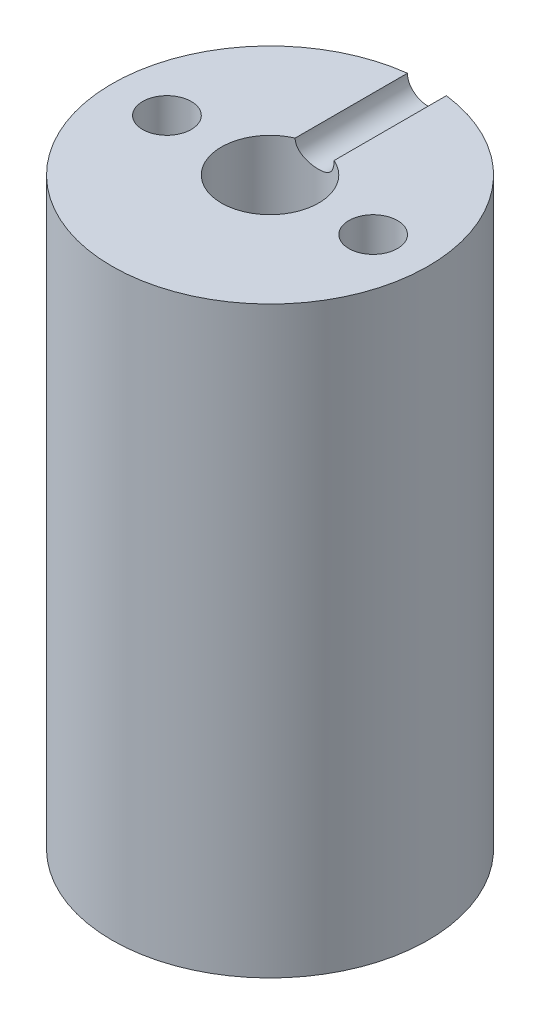
from build123d import *

# Parameters (mm, degrees)
SKETCH1_R               = 20.6375
BOSS_EXTRUDE1_DEPTH     = 76.2
SKETCH2_R               = 6.35
CUT_EXTRUDE1_DEPTH      = 38.1
CUT_REVOLVE_THIN1_START = -20.6375
CUT_REVOLVE_THIN1_DEPTH = 14.817629087
SKETCH4_R               = 3.175
CUT_EXTRUDE2_DEPTH      = 6.35


# Read off the part's stored shape, not the designer's step: Cut-Revolve-Thin1
with BuildPart() as part:
    # Sketch1 → Boss-Extrude1 (new body)
    with BuildSketch(Plane(origin=(0, 0, 0), x_dir=(1, 0, 0), z_dir=(0, 1, 0))):
        with Locations(Location((0, 0, 0), (0, 0, 90))):
            Circle(SKETCH1_R)
    extrude(amount=BOSS_EXTRUDE1_DEPTH)

    # Sketch2 → Cut-Extrude1 (cut)
    with BuildSketch(Plane(origin=(0, 76.2, 0), x_dir=(-1, 0, 0), z_dir=(0, 1, 0))):
        with Locations(Location((0, 0, 0), (0, 0, 90))):
            Circle(SKETCH2_R)
    extrude(amount=-CUT_EXTRUDE1_DEPTH, mode=Mode.SUBTRACT)

    # Cut-Revolve-Thin1 outline → Cut-Revolve-Thin1 (cut)
    with BuildSketch(Plane.XY.offset(CUT_REVOLVE_THIN1_START)):
        with BuildLine():
            Line((2.54, 76.2), (-2.54, 76.2))
            ThreePointArc((-2.54, 76.2), (0, 73.66), (2.54, 76.2))
        make_face()
    extrude(amount=CUT_REVOLVE_THIN1_DEPTH, mode=Mode.SUBTRACT)

    # Sketch4 → Cut-Extrude2 (cut)
    with BuildSketch(Plane(origin=(0, 76.2, 0), x_dir=(1, 0, 0), z_dir=(0, 1, 0))):
        with Locations(Location((-13.462, 0, 0), (0, 0, 270))):
            Circle(SKETCH4_R)
        with Locations(Location((13.462, 0, 0), (0, 0, 90))):
            Circle(SKETCH4_R)
    extrude(amount=-CUT_EXTRUDE2_DEPTH, mode=Mode.SUBTRACT)


solid = part.part
